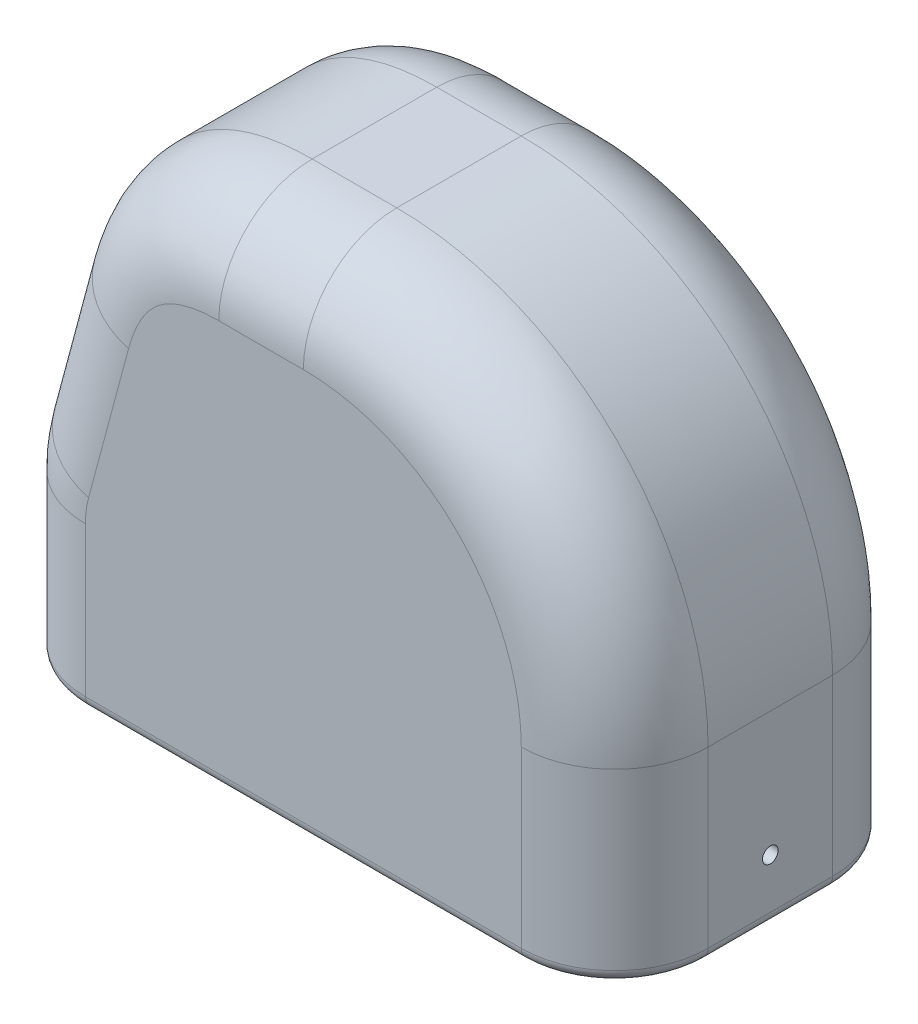
from build123d import *

# Parameters (mm, degrees)
SKETCH1_W                     = 100
SKETCH1_H                     = 50
BOSS_EXTRUDE1_DEPTH           = 80
FILLET1_R                     = 50
CUT_EXTRUDE1_DEPTH            = 107.77078252
FILLET11_R                    = 30
FILLET5_R                     = 15
FILLET6_R                     = 2
CUT_EXTRUDE5_DEPTH            = 5
CUT_EXTRUDE6_DEPTH            = 20
SKETCH15_R                    = 2.85
CUT_EXTRUDE7_DEPTH            = 4
M3X0_5_START                  = -50
M3X0_5_TAPPED_HOLE1_OUTLINE_R = 1.25
M3X0_5_TAPPED_HOLE1_DEPTH     = 6
M3X0_5_START_2                = 44
M3X0_5_TAPPED_HOLE2_OUTLINE_R = 1.25
M3X0_5_TAPPED_HOLE2_DEPTH     = 6


with BuildPart() as part:
    # Sketch1 → Boss-Extrude1 (new body)
    with BuildSketch(Plane(origin=(0, 0, 0), x_dir=(1, 0, 0), z_dir=(0, 1, 0))):
        Rectangle(SKETCH1_W, SKETCH1_H)
    extrude(amount=BOSS_EXTRUDE1_DEPTH)

    # Fillet1
    fillet1_edges = [part.edges().sort_by_distance(p)[0] for p in [
        (50, 80, 0),
    ]]
    fillet(fillet1_edges, radius=FILLET1_R)

    # Sketch4 → Cut-Extrude1 (cut, through all)
    with BuildSketch(Plane.XY.offset(25)):
        Polygon((-50, 80), (-36.602540378, 80), (-50, 30), align=None)
    extrude(amount=-CUT_EXTRUDE1_DEPTH, mode=Mode.SUBTRACT)

    # Fillet4
    # a fillet whose section is not a circle: 30 mm, written as the material it takes off along each edge
    with BuildSketch(Plane(origin=(-36.602540378, 80, 82.549524098), x_dir=(1, 0, 0), z_dir=(0, 0, -1))) as fillet4_piece_1:
        with BuildLine():
            Bezier((23.019809639, 0), (0, 0), (-5.957965149, 22.235428647), weights=[1, 0.952024008, 1])
            Line((-5.957965149, 22.235428647), (0, 0))
            Line((0, 0), (23.019809639, 0))
        make_face()
    extrude(amount=165.099048197, mode=Mode.SUBTRACT)

    # Fillet11
    fillet11_edges = [part.edges().sort_by_distance(p)[0] for p in [
        (-50, 30, 0),
    ]]
    fillet(fillet11_edges, radius=FILLET11_R)

    # Fillet5
    fillet5_edges = [part.edges().sort_by_distance(p)[0] for p in [
        (50, 15, -25),
        (35.355339059, 65.355339059, -25),
        (-6.79136537, 80, -25),
        (50, 15, 25),
        (35.355339059, 65.355339059, 25),
        (-6.79136537, 80, 25),
        (-32.23224462, 74.30451968, -25),
        (-32.23224462, 74.30451968, 25),
        (-45.769140158, 45.789783889, -25),
        (-45.769140158, 45.789783889, 25),
        (-50, 13.025212536, -25),
        (-49.743345841, 29.966210839, -25),
        (-50, 13.025212536, 25),
        (-49.743345841, 29.966210839, 25),
    ]]
    fillet(fillet5_edges, radius=FILLET5_R)

    # Fillet6
    fillet6_edges = [part.edges().sort_by_distance(p)[0] for p in [
        (-50, 0, 0),
        (50, 0, 0),
        (0, 0, 25),
        (0, 0, -25),
        (45.606601718, 0, 20.606601718),
        (-45.606601718, 0, 20.606601718),
        (45.606601718, 0, -20.606601718),
        (-45.606601718, 0, -20.606601718),
    ]]
    fillet(fillet6_edges, radius=FILLET6_R)

    # Sketch10 → Cut-Extrude5 (cut)
    with BuildSketch(Plane.XZ):
        with BuildLine():
            Line((-35, -20), (35, -20))
            ThreePointArc((35, -20), (42.071067812, -17.071067812), (45, -10))
            Line((45, -10), (45, 10))
            ThreePointArc((45, 10), (42.071067812, 17.071067812), (35, 20))
            Line((35, 20), (-35, 20))
            ThreePointArc((-35, 20), (-42.071067812, 17.071067812), (-45, 10))
            Line((-45, 10), (-45, -10))
            ThreePointArc((-45, -10), (-42.071067812, -17.071067812), (-35, -20))
        make_face()
    extrude(amount=-CUT_EXTRUDE5_DEPTH, mode=Mode.SUBTRACT)

    # Sketch14 → Cut-Extrude6 (cut)
    with BuildSketch(Plane.XZ.offset(-5)):
        with BuildLine():
            Line((35, 20), (-35, 20))
            ThreePointArc((-35, 20), (-42.071067812, 17.071067812), (-45, 10))
            Line((-45, 10), (-45, -10))
            ThreePointArc((-45, -10), (-42.071067812, -17.071067812), (-35, -20))
            Line((-35, -20), (35, -20))
            ThreePointArc((35, -20), (42.071067812, -17.071067812), (45, -10))
            Line((45, -10), (45, 10))
            ThreePointArc((45, 10), (42.071067812, 17.071067812), (35, 20))
        make_face()
        with BuildLine():
            Line((-40, 10), (-40, -10))
            ThreePointArc((-40, -10), (-38.535533906, -13.535533906), (-35, -15))
            Line((-35, -15), (35, -15))
            ThreePointArc((35, -15), (38.535533906, -13.535533906), (40, -10))
            Line((40, -10), (40, 10))
            ThreePointArc((40, 10), (38.535533906, 13.535533906), (35, 15))
            Line((35, 15), (-35, 15))
            ThreePointArc((-35, 15), (-38.535533906, 13.535533906), (-40, 10))
        make_face(mode=Mode.SUBTRACT)
    extrude(amount=-CUT_EXTRUDE6_DEPTH, mode=Mode.SUBTRACT)

    # M1.6x0.35 Tapped Hole1: read off the stored shape, not the designer's step
    # M1.6x0.35 Tapped Hole1 outline → M1.6x0.35 Tapped Hole1 (revolve, cut)
    with BuildSketch(Plane(origin=(25, 0, 0), x_dir=(1, 0, 0), z_dir=(0, 0, 1))):
        Polygon((0.625, 9.25), (0, 9.625537887), (0, 5), (0.625, 5), align=None)
    revolve(axis=Axis((25, 0, 0), (0, 1, 0)), mode=Mode.SUBTRACT)

    # M1.6x0.35 Tapped Hole1 2 outline → M1.6x0.35 Tapped Hole1 2 (revolve, cut)
    with BuildSketch(Plane(origin=(35, 0, 10), x_dir=(1, 0, 0), z_dir=(0, 0, 1))):
        Polygon((0.625, 9.25), (0, 9.625537887), (0, 5), (0.625, 5), align=None)
    revolve(axis=Axis((35, 0, 10), (0, 1, 0)), mode=Mode.SUBTRACT)

    # M1.6x0.35 Tapped Hole1 3 outline → M1.6x0.35 Tapped Hole1 3 (revolve, cut)
    with BuildSketch(Plane(origin=(25, 0, 10), x_dir=(1, 0, 0), z_dir=(0, 0, 1))):
        Polygon((0.625, 9.25), (0, 9.625537887), (0, 5), (0.625, 5), align=None)
    revolve(axis=Axis((25, 0, 10), (0, 1, 0)), mode=Mode.SUBTRACT)

    # M1.6x0.35 Tapped Hole1 4 outline → M1.6x0.35 Tapped Hole1 4 (revolve, cut)
    with BuildSketch(Plane(origin=(35, 0, 0), x_dir=(1, 0, 0), z_dir=(0, 0, 1))):
        Polygon((0.625, 9.25), (0, 9.625537887), (0, 5), (0.625, 5), align=None)
    revolve(axis=Axis((35, 0, 0), (0, 1, 0)), mode=Mode.SUBTRACT)

    # M1.6x0.35 Tapped Hole1 5 outline → M1.6x0.35 Tapped Hole1 5 (revolve, cut)
    with BuildSketch(Plane(origin=(-35, 0, 0), x_dir=(1, 0, 0), z_dir=(0, 0, 1))):
        Polygon((0.625, 9.25), (0, 9.625537887), (0, 5), (0.625, 5), align=None)
    revolve(axis=Axis((-35, 0, 0), (0, 1, 0)), mode=Mode.SUBTRACT)

    # M1.6x0.35 Tapped Hole1 6 outline → M1.6x0.35 Tapped Hole1 6 (revolve, cut)
    with BuildSketch(Plane(origin=(-25, 0, 10), x_dir=(1, 0, 0), z_dir=(0, 0, 1))):
        Polygon((0.625, 9.25), (0, 9.625537887), (0, 5), (0.625, 5), align=None)
    revolve(axis=Axis((-25, 0, 10), (0, 1, 0)), mode=Mode.SUBTRACT)

    # M1.6x0.35 Tapped Hole1 7 outline → M1.6x0.35 Tapped Hole1 7 (revolve, cut)
    with BuildSketch(Plane(origin=(-35, 0, 10), x_dir=(1, 0, 0), z_dir=(0, 0, 1))):
        Polygon((0.625, 9.25), (0, 9.625537887), (0, 5), (0.625, 5), align=None)
    revolve(axis=Axis((-35, 0, 10), (0, 1, 0)), mode=Mode.SUBTRACT)

    # M1.6x0.35 Tapped Hole1 8 outline → M1.6x0.35 Tapped Hole1 8 (revolve, cut)
    with BuildSketch(Plane(origin=(-25, 0, 0), x_dir=(1, 0, 0), z_dir=(0, 0, 1))):
        Polygon((0.625, 9.25), (0, 9.625537887), (0, 5), (0.625, 5), align=None)
    revolve(axis=Axis((-25, 0, 0), (0, 1, 0)), mode=Mode.SUBTRACT)

    # M1.6x0.35 Tapped Hole1 9 outline → M1.6x0.35 Tapped Hole1 9 (revolve, cut)
    with BuildSketch(Plane(origin=(-35, 0, -10), x_dir=(1, 0, 0), z_dir=(0, 0, 1))):
        Polygon((0.625, 9.25), (0, 9.625537887), (0, 5), (0.625, 5), align=None)
    revolve(axis=Axis((-35, 0, -10), (0, 1, 0)), mode=Mode.SUBTRACT)

    # M1.6x0.35 Tapped Hole1 10 outline → M1.6x0.35 Tapped Hole1 10 (revolve, cut)
    with BuildSketch(Plane(origin=(-25, 0, -10), x_dir=(1, 0, 0), z_dir=(0, 0, 1))):
        Polygon((0.625, 9.25), (0, 9.625537887), (0, 5), (0.625, 5), align=None)
    revolve(axis=Axis((-25, 0, -10), (0, 1, 0)), mode=Mode.SUBTRACT)

    # M1.6x0.35 Tapped Hole1 11 outline → M1.6x0.35 Tapped Hole1 11 (revolve, cut)
    with BuildSketch(Plane(origin=(25, 0, -10), x_dir=(1, 0, 0), z_dir=(0, 0, 1))):
        Polygon((0.625, 9.25), (0, 9.625537887), (0, 5), (0.625, 5), align=None)
    revolve(axis=Axis((25, 0, -10), (0, 1, 0)), mode=Mode.SUBTRACT)

    # M1.6x0.35 Tapped Hole1 12 outline → M1.6x0.35 Tapped Hole1 12 (revolve, cut)
    with BuildSketch(Plane(origin=(35, 0, -10), x_dir=(1, 0, 0), z_dir=(0, 0, 1))):
        Polygon((0.625, 9.25), (0, 9.625537887), (0, 5), (0.625, 5), align=None)
    revolve(axis=Axis((35, 0, -10), (0, 1, 0)), mode=Mode.SUBTRACT)

    # Sketch15 → Cut-Extrude7 (cut)
    with BuildSketch(Plane.XZ.offset(-5)):
        with Locations(Location((-18, 10, 0), (0, 0, 270))):
            Circle(SKETCH15_R)
        with Locations(Location((18, 10, 0), (0, 0, 270))):
            Circle(SKETCH15_R)
        with Locations(Location((18, -10, 0), (0, 0, 270))):
            Circle(SKETCH15_R)
        with Locations(Location((-18, -10, 0), (0, 0, 270))):
            Circle(SKETCH15_R)
    extrude(amount=-CUT_EXTRUDE7_DEPTH, mode=Mode.SUBTRACT)

    # M3x0.5 Tapped Hole1: read off the stored shape, not the designer's step
    # M3x0.5 Tapped Hole1 outline → M3x0.5 Tapped Hole1 (cut)
    with BuildSketch(Plane.YZ.offset(M3X0_5_START)):
        with Locations((10, 0)):
            Circle(M3X0_5_TAPPED_HOLE1_OUTLINE_R)
    extrude(amount=M3X0_5_TAPPED_HOLE1_DEPTH, mode=Mode.SUBTRACT)

    # M3x0.5 Tapped Hole2: read off the stored shape, not the designer's step
    # M3x0.5 Tapped Hole2 outline → M3x0.5 Tapped Hole2 (cut)
    with BuildSketch(Plane.YZ.offset(M3X0_5_START_2)):
        with Locations((10, 0)):
            Circle(M3X0_5_TAPPED_HOLE2_OUTLINE_R)
    extrude(amount=M3X0_5_TAPPED_HOLE2_DEPTH, mode=Mode.SUBTRACT)


solid = part.part
